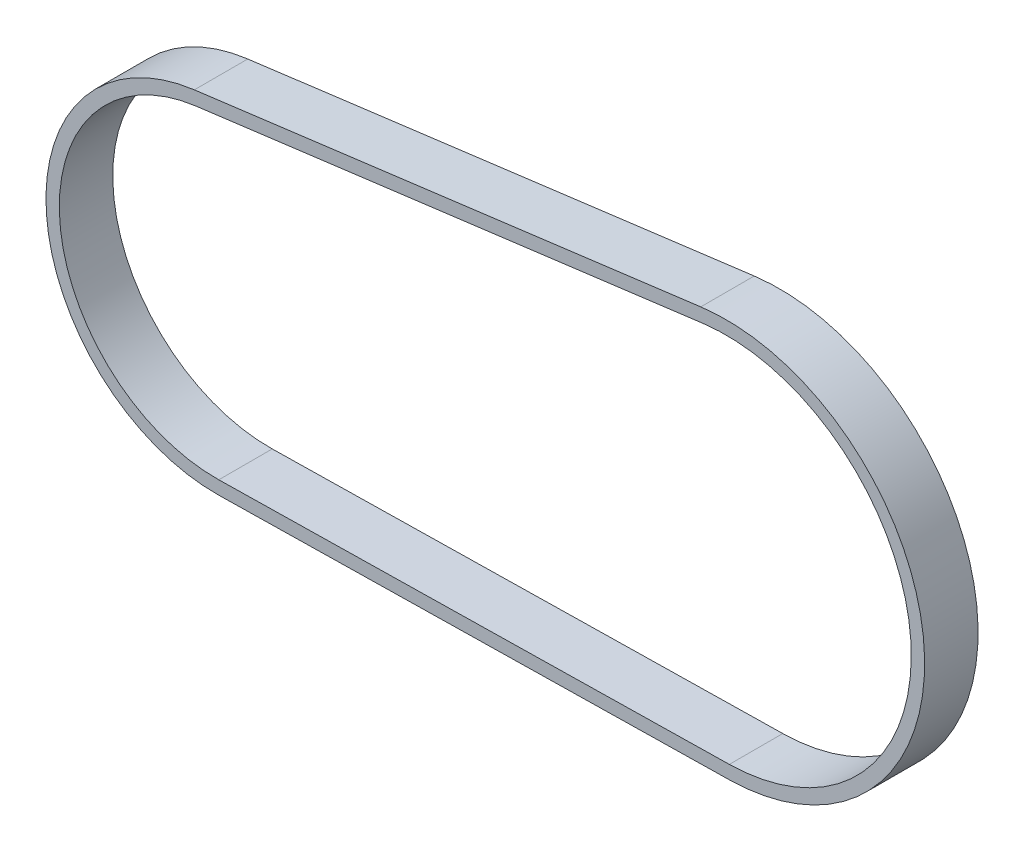
from build123d import *

# Parameters (mm, degrees)
EXTRUDE_THIN1_DEPTH = 6


with BuildPart() as part:
    # Sketch2 → Extrude-Thin1 (new body)
    with BuildSketch(Plane.XY):
        with BuildLine():
            Line((-59.701357787, 14.771499387), (-2.848173116, 22.098907433))
            ThreePointArc((-2.848173116, 22.098907433), (22.222827909, 1.618554776), (0.383957227, -22.278383619))
            Line((0.383957227, -22.278383619), (-56.93096035, -23.266178658))
            ThreePointArc((-56.93096035, -23.266178658), (-76.308204752, -5.557753936), (-59.701357787, 14.771499387))
        make_face()
        with BuildLine():
            Line((-59.509619221, 13.283804417), (-2.65643455, 20.611212464))
            ThreePointArc((-2.65643455, 20.611212464), (20.726790633, 1.509593924), (0.358109287, -20.778606341))
            Line((0.358109287, -20.778606341), (-56.95680829, -21.76640138))
            ThreePointArc((-56.95680829, -21.76640138), (-74.812167476, -5.448793083), (-59.509619221, 13.283804417))
        make_face(mode=Mode.SUBTRACT)
    extrude(amount=-EXTRUDE_THIN1_DEPTH)


solid = part.part
